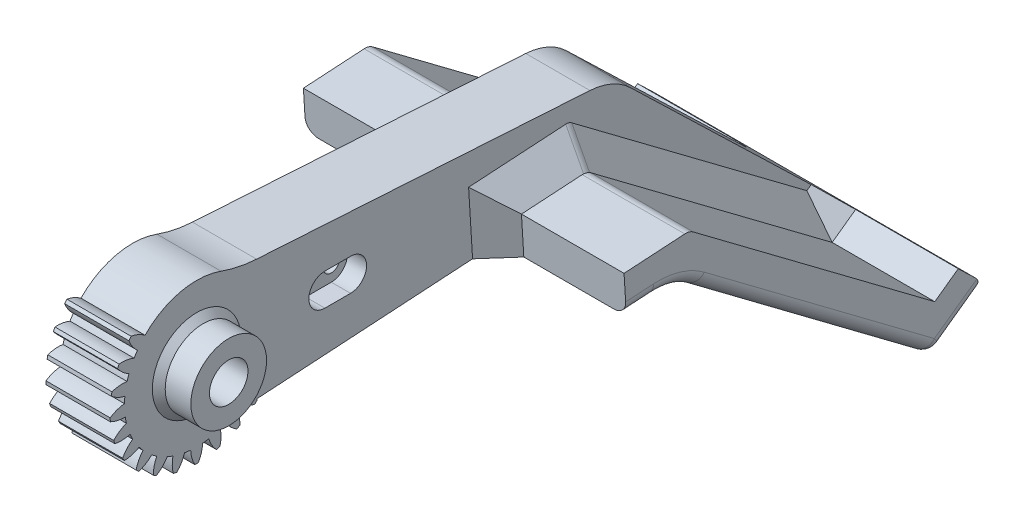
from build123d import *

# Parameters (mm, degrees)
BASPROSKE_W              = 10
BASPROSKE_H              = 13.5
TOOTHCUT_DEPTH           = 22.552262062
TEETHCUTS_COUNT          = 25
BORSKE_R                 = 4
BORE_DEPTH               = 50.0000508
BOSS_EXTRUDE1_DEPTH      = 10
CUT_EXTRUDE4_DEPTH       = 1
SKETCH6_R                = 1.25
CUT_EXTRUDE5_DEPTH       = 68.136055887
CUT_EXTRUDE6_DEPTH       = 3
SKETCH7_R                = 4
SKETCH7_R_2              = 3
BOSS_EXTRUDE2_DEPTH      = 9
BOSS_EXTRUDE3_START      = 5
SKETCH7_3_R              = 5.9
SKETCH7_3_R_2            = 3
BOSS_EXTRUDE3_DEPTH      = 5
CHAMFER1_SIZE            = 1
BOSS_EXTRUDE4_DEPTH      = 10
BOSS_EXTRUDE6_DEPTH      = 20
BOSS_EXTRUDE6_DEPTH_BACK = 30
CHAMFER3_SIZE            = 4
FILLET4_R                = 10
FILLET5_R                = 2
CUT_EXTRUDE7_START       = -10
CUT_EXTRUDE7_DEPTH       = 10
FILLET6_R                = 20


with BuildPart() as part:
    # BasProSke → Base-Revolve (revolve)
    with BuildSketch(Plane(origin=(0, 0, 0), x_dir=(1, 0, 0), z_dir=(0, 1, 0)), mode=Mode.PRIVATE) as base_revolve_sk:
        with Locations((5, 6.75)):
            Rectangle(BASPROSKE_W, BASPROSKE_H)
    revolve(base_revolve_sk.sketch.rotate(Axis((-10, 0, 0), (1, 0, 0)), 180), axis=Axis((-10, 0, 0), (1, 0, 0)))

    # TooCutSke → ToothCut (cut, through all)
    with BuildSketch(Plane(origin=(0, 0, 0), x_dir=(0, 0, -1), z_dir=(1, 0, 0))):
        with BuildLine():
            ThreePointArc((0.480087995, 11.238750665), (0, 11.249), (-0.480087995, 11.238750665))
            ThreePointArc((-0.480087995, 11.238750665), (-0.821124963, 12.40220054), (-1.432168974, 13.449361962))
            ThreePointArc((-1.432168974, 13.449361962), (0, 13.5254), (1.432168974, 13.449361962))
            ThreePointArc((1.432168974, 13.449361962), (0.821124963, 12.40220054), (0.480087995, 11.238750665))
        make_face()
    toothcut = extrude(amount=TOOTHCUT_DEPTH, mode=Mode.SUBTRACT)

    # TeethCuts: ToothCut ×25 about axis
    teethcuts_axis = Axis((0, 0, 0), (1, 0, 0))
    for i in range(1, TEETHCUTS_COUNT):
        add(toothcut.rotate(teethcuts_axis, i * 360 / TEETHCUTS_COUNT), mode=Mode.SUBTRACT)

    # BorSke → Bore (cut, symmetric)
    with BuildSketch(Plane(origin=(0, 0, 0), x_dir=(0, 0, -1), z_dir=(1, 0, 0))):
        with Locations(Location((0, 0, 0), (0, 0, 180))):
            Circle(BORSKE_R)
    extrude(amount=BORE_DEPTH, both=True, mode=Mode.SUBTRACT)

    # Sketch4 → Boss-Extrude1 (add)
    with BuildSketch(Plane(origin=(10, 0, 0), x_dir=(0, 0, -1), z_dir=(1, 0, 0))):
        with BuildLine():
            ThreePointArc((10, 0), (7.285994832, -6.849399923), (0.61714414, -9.980938488))
            Line((0.61714414, -9.980938488), (65, -6))
            Line((65, -6), (65, 6))
            Line((65, 6), (0.61714414, 9.980938488))
            ThreePointArc((0.61714414, 9.980938488), (7.285994832, 6.849399923), (10, 0))
        make_face()
    extrude(amount=-BOSS_EXTRUDE1_DEPTH)

    # Sketch5 → Cut-Extrude4 (cut)
    with BuildSketch(Plane.ZY):
        with BuildLine():
            Line((-28.5, 3.464101615), (-1.071428571, 7.42307489))
            ThreePointArc((-1.071428571, 7.42307489), (7.5, 0), (-1.071428571, -7.42307489))
            Line((-1.071428571, -7.42307489), (-28.5, -3.464101615))
            ThreePointArc((-28.5, -3.464101615), (-31.5, 0), (-28.5, 3.464101615))
        make_face()
    extrude(amount=-CUT_EXTRUDE4_DEPTH, mode=Mode.SUBTRACT)

    # Sketch6 → Cut-Extrude5 (cut, through all)
    with BuildSketch(Plane(origin=(10, 0, 0), x_dir=(0, 0, -1), z_dir=(1, 0, 0))):
        with Locations((20, 0)):
            Circle(SKETCH6_R)
        with Locations((24, 0)):
            Circle(SKETCH6_R)
    extrude(amount=-CUT_EXTRUDE5_DEPTH, mode=Mode.SUBTRACT)

    # Sketch6<3> → Cut-Extrude6 (cut)
    with BuildSketch(Plane(origin=(10, 0, 0), x_dir=(0, 0, -1), z_dir=(1, 0, 0))):
        with BuildLine():
            Line((20, 2.5), (24, 2.5))
            ThreePointArc((24, 2.5), (26.5, 0), (24, -2.5))
            Line((24, -2.5), (20, -2.5))
            ThreePointArc((20, -2.5), (17.5, 0), (20, 2.5))
        make_face()
    extrude(amount=-CUT_EXTRUDE6_DEPTH, mode=Mode.SUBTRACT)

    # Sketch7 → Boss-Extrude2 (add)
    with BuildSketch(Plane(origin=(10, 0, 0), x_dir=(0, 0, -1), z_dir=(1, 0, 0))):
        Circle(SKETCH7_R)
        Circle(SKETCH7_R_2, mode=Mode.SUBTRACT)
    extrude(amount=-BOSS_EXTRUDE2_DEPTH)

    # Sketch7<3> → Boss-Extrude3 (add)
    with BuildSketch(Plane(origin=(10, 0, 0), x_dir=(0, 0, -1), z_dir=(1, 0, 0)).offset(BOSS_EXTRUDE3_START)):
        with Locations(Location((0, 0, 0), (0, 0, 180))):
            Circle(SKETCH7_3_R)
        Circle(SKETCH7_3_R_2, mode=Mode.SUBTRACT)
    extrude(amount=-BOSS_EXTRUDE3_DEPTH)

    # Chamfer1
    chamfer1_edges = [part.edges().sort_by_distance(p)[0] for p in [
        (10, 0, -5.9),
    ]]
    chamfer(chamfer1_edges, length=CHAMFER1_SIZE)

    # Sketch8 → Boss-Extrude4 (add)
    with BuildSketch(Plane(origin=(10, 0, 0), x_dir=(0, 0, -1), z_dir=(1, 0, 0))):
        Polygon((65, -6), (55.019061512, -6.61714414), (95.019061512, -36.61714414), (103.148018869, -30.79305174), (65, 6), align=None)
    extrude(amount=-BOSS_EXTRUDE4_DEPTH)

    # Sketch13 → Boss-Extrude6 (add, two sides: drawn at the far end of the back side and taken through both)
    with BuildSketch(Plane(origin=(10, 0, 0), x_dir=(0, 0, -1), z_dir=(1, 0, 0)).offset(-BOSS_EXTRUDE6_DEPTH_BACK)):
        Polygon((95.019061512, -36.61714414), (103.148018869, -30.79305174), (98.757020985, -26.558016288), (95.100195272, -29.17799446), (56.852619126, -0.492312351), (46.648775028, -1.123239251), (47.019061512, -7.111802344), (55.019061512, -6.61714414), align=None)
    extrude(amount=BOSS_EXTRUDE6_DEPTH + BOSS_EXTRUDE6_DEPTH_BACK)

    # Chamfer3
    chamfer3_edges = [part.edges().sort_by_distance(p)[0] for p in [
        (0, -14.835153405, -75.976407199),
        (0, -0.807775801, -51.750697077),
        (10, -0.807775801, -51.750697077),
        (10, -14.835153405, -75.976407199),
        (10, -4.117520798, -46.83391827),
        (0, -4.117520798, -46.83391827),
        (10, -27.868005374, -96.928608129),
        (0, -27.868005374, -96.928608129),
    ]]
    chamfer(chamfer3_edges, length=CHAMFER3_SIZE)

    # Fillet4
    fillet4_edges = [part.edges().sort_by_distance(p)[0] for p in [
        (5, 6, -65),
        (5, -6.61714414, -55.019061512),
    ]]
    fillet(fillet4_edges, radius=FILLET4_R)

    # Fillet5
    # the kernel refuses this fillet: 2 mm, written as the material it takes off along each edge
    with BuildSketch(Plane(origin=(28, -34.13742758, -95.046106098), x_dir=(0, -0.8128957357715318, -0.5824092399374), z_dir=(1, 0, 0))) as fillet5_piece_1_section:
        Polygon((0, 0), (FILLET5_R, 0), (FILLET5_R, -FILLET5_R * 0.733097133134), (FILLET5_R * 0.300871044655, -FILLET5_R * 0.953664833413), align=None)
    fillet5_piece_1 = extrude(amount=FILLET5_R, mode=Mode.PRIVATE)
    fillet5_piece_1 = fillet5_piece_1 - Plane(origin=(28, -34.13742758, -95.046106098), x_dir=(0, 0.9999405313766578, -0.01090567330187733), z_dir=(1, 0, 0)) * Sphere(FILLET5_R, mode=Mode.PRIVATE)
    add(fillet5_piece_1, mode=Mode.SUBTRACT)
    with BuildSketch(Plane(origin=(-18, -34.13742758, -95.046106098), x_dir=(0, -0.8, 0.5999999999999999), z_dir=(-1, 0, 0))) as fillet5_piece_2_section:
        Polygon((0, 0), (FILLET5_R, 0), (FILLET5_R, -FILLET5_R * 0.733097133134), (FILLET5_R * 0.300871044655, -FILLET5_R * 0.953664833413), align=None)
    fillet5_piece_2 = extrude(amount=FILLET5_R, mode=Mode.PRIVATE)
    fillet5_piece_2 = fillet5_piece_2 - Plane(origin=(-18, -34.13742758, -95.046106098), x_dir=(0, 0.9999405313766578, -0.01090567330187733), z_dir=(-1, 0, 0)) * Sphere(FILLET5_R, mode=Mode.PRIVATE)
    add(fillet5_piece_2, mode=Mode.SUBTRACT)
    with BuildSketch(Plane(origin=(36.002852697, -30.79305174, -103.148018869), x_dir=(0, 0.6942085233990521, 0.7197739409287527), z_dir=(-1, 0, 0))) as fillet5_piece_3:
        with BuildLine():
            CenterArc((FILLET5_R * 1.20057053937, -FILLET5_R), FILLET5_R, 90, 100.415644969)
            Line((FILLET5_R * 0.217048397101, -FILLET5_R * 1.18078770883), (0, 0))
            Line((0, 0), (FILLET5_R * 1.20057053937, 0))
        make_face()
    extrude(amount=62.005705394, mode=Mode.SUBTRACT)
    with BuildSketch(Plane(origin=(28, -36.61714414, -95.019061512), x_dir=(0, 0.5824092399373941, -0.8128957357715361), z_dir=(-1, 0, 0))) as fillet5_piece_4:
        with BuildLine():
            CenterArc((FILLET5_R * 0.733097133134, -FILLET5_R), FILLET5_R, 90, 72.490072413)
            Line((-FILLET5_R * 0.220567700279, -FILLET5_R * 0.699128955345), (0, 0))
            Line((0, 0), (FILLET5_R * 0.733097133134, 0))
        make_face()
    extrude(amount=46, mode=Mode.SUBTRACT)
    with BuildSketch(Plane(origin=(-2.159955849, -0.492312351, -56.852619126), x_dir=(0, -0.6000000000000031, -0.7999999999999977), z_dir=(-1, 0, 0))) as fillet5_piece_5_section:
        with BuildLine():
            CenterArc((FILLET5_R * 0.368008830226, FILLET5_R), FILLET5_R, 229.591878484, 40.408121516)
            Line((-FILLET5_R * 0.280219010245, FILLET5_R * 0.238553569292), (0, 0))
            Line((0, 0), (FILLET5_R * 0.368008830226, 0))
        make_face()
    fillet5_piece_5 = extrude(amount=19.680088302, mode=Mode.PRIVATE)
    fillet5_piece_5 = split(fillet5_piece_5, bisect_by=Plane(origin=(-4.203231672, -0.458393673, -56.468674771), z_dir=(0.7071067811865478, -0.5656854249492378, 0.42426406871192845)), keep=Keep.TOP, mode=Mode.PRIVATE)
    fillet5_piece_5 = split(fillet5_piece_5, bisect_by=Plane(origin=(-4.06457193, -0.583055288, -56.4313555), z_dir=(-0.7071067811865477, 0.7057589287818163, 0.04363868060268578)), keep=Keep.TOP, mode=Mode.PRIVATE)
    add(fillet5_piece_5, mode=Mode.SUBTRACT)
    with BuildSketch(Plane(origin=(-2.159955849, -0.492312351, -56.852619126), x_dir=(0, -0.6000000000000031, -0.7999999999999977), z_dir=(-1, 0, 0))) as fillet5_piece_6_section:
        with BuildLine():
            CenterArc((FILLET5_R * 0.368008830226, FILLET5_R), FILLET5_R, 229.591878484, 40.408121516)
            Line((-FILLET5_R * 0.280219010245, FILLET5_R * 0.238553569292), (0, 0))
            Line((0, 0), (FILLET5_R * 0.368008830226, 0))
        make_face()
    fillet5_piece_6 = extrude(amount=19.680088302, mode=Mode.PRIVATE)
    fillet5_piece_6 = split(fillet5_piece_6, bisect_by=Plane(origin=(-4.06457193, -0.799606363, -57.154724593), z_dir=(-0.7071067811865478, 0.5656854249492378, -0.42426406871192845)), keep=Keep.TOP, mode=Mode.PRIVATE)
    fillet5_piece_6 = split(fillet5_piece_6, bisect_by=Plane(origin=(-4.203231672, -0.674944749, -57.192043864), z_dir=(0.7071067811865477, -0.7057589287818163, -0.04363868060268578)), keep=Keep.TOP, mode=Mode.PRIVATE)
    add(fillet5_piece_6, mode=Mode.SUBTRACT)
    with BuildSketch(Plane(origin=(-2.159955849, -0.492312351, -56.852619126), x_dir=(0, -0.6000000000000031, -0.7999999999999977), z_dir=(-1, 0, 0))) as fillet5_piece_7_section:
        with BuildLine():
            CenterArc((FILLET5_R * 0.368008830226, FILLET5_R), FILLET5_R, 229.591878484, 40.408121516)
            Line((-FILLET5_R * 0.280219010245, FILLET5_R * 0.238553569292), (0, 0))
            Line((0, 0), (FILLET5_R * 0.368008830226, 0))
        make_face()
    fillet5_piece_7 = extrude(amount=19.680088302, mode=Mode.PRIVATE)
    fillet5_piece_7 = split(fillet5_piece_7, bisect_by=Plane(origin=(-8.556310311, -4.159124807, -54.147851884), z_dir=(-0.7071067811865478, 0.5656854249492378, -0.42426406871192845)), keep=Keep.TOP, mode=Mode.PRIVATE)
    fillet5_piece_7 = split(fillet5_piece_7, bisect_by=Plane(origin=(-8.556310311, -5.042176254, -57.097604611), z_dir=(-0.7071067811865477, 0.7057589287818163, 0.04363868060268578)), keep=Keep.TOP, mode=Mode.PRIVATE)
    add(fillet5_piece_7, mode=Mode.SUBTRACT)
    with BuildSketch(Plane(origin=(-20, -7.420374414, -42.028592267), x_dir=(1, 0, 0), z_dir=(0, 0.061714413952385916, -0.9980938488491519))) as fillet5_piece_8:
        with BuildLine():
            CenterArc((FILLET5_R, -FILLET5_R), FILLET5_R, 90, 90)
            Line((0, -FILLET5_R), (0, 0))
            Line((0, 0), (FILLET5_R, 0))
        make_face()
    extrude(amount=9.33519003, mode=Mode.SUBTRACT)
    with BuildSketch(Plane(origin=(-20, -35.763219051, -96.210924578), x_dir=(1, 0, 0), z_dir=(0, 0.5824092399373993, -0.8128957357715324)), Plane(origin=(30, -35.763219051, -96.210924578), x_dir=(0, 0.8128957357715324, 0.5824092399373992), z_dir=(0, 0.5824092399373993, -0.8128957357715324))) as fillet5_piece_9:
        with BuildLine():
            CenterArc((FILLET5_R, -FILLET5_R), FILLET5_R, 90, 90)
            Line((0, -FILLET5_R), (0, 0))
            Line((0, 0), (FILLET5_R, 0))
        make_face()
    extrude(amount=13.533805734, mode=Mode.SUBTRACT)
    with BuildSketch(Plane(origin=(30, -7.420374414, -42.028592267), x_dir=(-1, 0, 0), z_dir=(0, 0.061714413952385916, -0.9980938488491519))) as fillet5_piece_10:
        with BuildLine():
            CenterArc((FILLET5_R, FILLET5_R), FILLET5_R, 180, 90)
            Line((0, FILLET5_R), (0, 0))
            Line((0, 0), (FILLET5_R, 0))
        make_face()
    extrude(amount=9.33519003, mode=Mode.SUBTRACT)
    with BuildSketch(Plane(origin=(31.840044151, -0.492312351, -56.852619126), x_dir=(0, -0.6000000000000031, -0.7999999999999977), z_dir=(-1, 0, 0))) as fillet5_piece_11_section:
        with BuildLine():
            CenterArc((FILLET5_R * 0.368008830226, FILLET5_R), FILLET5_R, 229.591878484, 40.408121516)
            Line((-FILLET5_R * 0.280219010245, FILLET5_R * 0.238553569292), (0, 0))
            Line((0, 0), (FILLET5_R * 0.368008830226, 0))
        make_face()
    fillet5_piece_11 = extrude(amount=19.680088302, mode=Mode.PRIVATE)
    fillet5_piece_11 = split(fillet5_piece_11, bisect_by=Plane(origin=(18.556310311, -4.159124807, -54.147851884), z_dir=(0.7071067811865477, 0.5656854249492382, -0.42426406871192823)), keep=Keep.TOP, mode=Mode.PRIVATE)
    fillet5_piece_11 = split(fillet5_piece_11, bisect_by=Plane(origin=(18.556310311, -5.042176254, -57.097604611), z_dir=(0.7071067811865477, 0.7057589287818162, 0.04363868060268581)), keep=Keep.TOP, mode=Mode.PRIVATE)
    add(fillet5_piece_11, mode=Mode.SUBTRACT)
    with BuildSketch(Plane(origin=(31.840044151, -0.492312351, -56.852619126), x_dir=(0, -0.6000000000000031, -0.7999999999999977), z_dir=(-1, 0, 0))) as fillet5_piece_12_section:
        with BuildLine():
            CenterArc((FILLET5_R * 0.368008830226, FILLET5_R), FILLET5_R, 229.591878484, 40.408121516)
            Line((-FILLET5_R * 0.280219010245, FILLET5_R * 0.238553569292), (0, 0))
            Line((0, 0), (FILLET5_R * 0.368008830226, 0))
        make_face()
    fillet5_piece_12 = extrude(amount=19.680088302, mode=Mode.PRIVATE)
    fillet5_piece_12 = split(fillet5_piece_12, bisect_by=Plane(origin=(14.203231672, -0.458393673, -56.468674771), z_dir=(-0.7071067811865477, -0.5656854249492382, 0.42426406871192823)), keep=Keep.TOP, mode=Mode.PRIVATE)
    fillet5_piece_12 = split(fillet5_piece_12, bisect_by=Plane(origin=(14.06457193, -0.583055288, -56.4313555), z_dir=(0.7071067811865477, 0.7057589287818162, 0.04363868060268581)), keep=Keep.TOP, mode=Mode.PRIVATE)
    add(fillet5_piece_12, mode=Mode.SUBTRACT)
    with BuildSketch(Plane(origin=(31.840044151, -0.492312351, -56.852619126), x_dir=(0, -0.6000000000000031, -0.7999999999999977), z_dir=(-1, 0, 0))) as fillet5_piece_13_section:
        with BuildLine():
            CenterArc((FILLET5_R * 0.368008830226, FILLET5_R), FILLET5_R, 229.591878484, 40.408121516)
            Line((-FILLET5_R * 0.280219010245, FILLET5_R * 0.238553569292), (0, 0))
            Line((0, 0), (FILLET5_R * 0.368008830226, 0))
        make_face()
    fillet5_piece_13 = extrude(amount=19.680088302, mode=Mode.PRIVATE)
    fillet5_piece_13 = split(fillet5_piece_13, bisect_by=Plane(origin=(14.06457193, -0.799606363, -57.154724593), z_dir=(0.7071067811865477, 0.5656854249492382, -0.42426406871192823)), keep=Keep.TOP, mode=Mode.PRIVATE)
    fillet5_piece_13 = split(fillet5_piece_13, bisect_by=Plane(origin=(14.203231672, -0.674944749, -57.192043864), z_dir=(-0.7071067811865477, -0.7057589287818162, -0.04363868060268581)), keep=Keep.TOP, mode=Mode.PRIVATE)
    add(fillet5_piece_13, mode=Mode.SUBTRACT)
    with BuildSketch(Plane(origin=(0.861673631, 4.470509849, -58.338312244), x_dir=(0.17807400283141436, -0.438202960830783, -0.8810606191600738), z_dir=(-0.6843169218392868, -0.698554339417582, 0.20912241717536942))) as fillet5_piece_14_section:
        with BuildLine():
            CenterArc((FILLET5_R * 0.25183466991, FILLET5_R), FILLET5_R, 241.729727879, 28.270272121)
            Line((-FILLET5_R * 0.221796640221, FILLET5_R * 0.119276784646), (0, 0))
            Line((0, 0), (FILLET5_R * 0.25183466991, 0))
        make_face()
    fillet5_piece_14 = extrude(amount=8.363591603, mode=Mode.PRIVATE)
    fillet5_piece_14 = split(fillet5_piece_14, bisect_by=Plane(origin=(0, 1.554477972, -57.465355625), z_dir=(-1, 0, 0)), keep=Keep.TOP, mode=Mode.PRIVATE)
    fillet5_piece_14 = split(fillet5_piece_14, bisect_by=Plane(origin=(-1.935281767, -0.049581354, -56.26231113), z_dir=(0, 0.8000000000000003, -0.5999999999999998)), keep=Keep.TOP, mode=Mode.PRIVATE)
    fillet5_piece_14 = split(fillet5_piece_14, bisect_by=Plane(origin=(-1.935281767, -0.446774211, -57.589097601), z_dir=(0, 0.9980938488491519, 0.061714413952385944)), keep=Keep.TOP, mode=Mode.PRIVATE)
    add(fillet5_piece_14, mode=Mode.SUBTRACT)
    with BuildSketch(Plane(origin=(0.861673631, 4.470509849, -58.338312244), x_dir=(0.17807400283141436, -0.438202960830783, -0.8810606191600738), z_dir=(-0.6843169218392868, -0.698554339417582, 0.20912241717536942))) as fillet5_piece_15_section:
        with BuildLine():
            CenterArc((FILLET5_R * 0.25183466991, FILLET5_R), FILLET5_R, 241.729727879, 28.270272121)
            Line((-FILLET5_R * 0.221796640221, FILLET5_R * 0.119276784646), (0, 0))
            Line((0, 0), (FILLET5_R * 0.25183466991, 0))
        make_face()
    fillet5_piece_15 = extrude(amount=8.363591603, mode=Mode.PRIVATE)
    fillet5_piece_15 = split(fillet5_piece_15, bisect_by=Plane(origin=(-3.914909167, -0.322114943, -56.62568925), z_dir=(0, -0.8000000000000003, 0.5999999999999998)), keep=Keep.TOP, mode=Mode.PRIVATE)
    fillet5_piece_15 = split(fillet5_piece_15, bisect_by=Plane(origin=(-3.914909167, -0.509818406, -56.569497483), z_dir=(0, 0.9980938488491519, 0.061714413952385944)), keep=Keep.TOP, mode=Mode.PRIVATE)
    add(fillet5_piece_15, mode=Mode.SUBTRACT)
    with BuildSketch(Plane(origin=(0.861673631, 4.470509849, -58.338312244), x_dir=(0.17807400283141436, -0.438202960830783, -0.8810606191600738), z_dir=(-0.6843169218392868, -0.698554339417582, 0.20912241717536942))) as fillet5_piece_16_section:
        with BuildLine():
            CenterArc((FILLET5_R * 0.25183466991, FILLET5_R), FILLET5_R, 241.729727879, 28.270272121)
            Line((-FILLET5_R * 0.221796640221, FILLET5_R * 0.119276784646), (0, 0))
            Line((0, 0), (FILLET5_R * 0.25183466991, 0))
        make_face()
    fillet5_piece_16 = extrude(amount=8.363591603, mode=Mode.PRIVATE)
    fillet5_piece_16 = split(fillet5_piece_16, bisect_by=Plane(origin=(-3.914909167, -0.662509759, -57.079549004), z_dir=(0, 0.8000000000000003, -0.5999999999999998)), keep=Keep.TOP, mode=Mode.PRIVATE)
    fillet5_piece_16 = split(fillet5_piece_16, bisect_by=Plane(origin=(-3.914909167, -0.474806295, -57.135740769), z_dir=(0, -0.9980938488491519, -0.061714413952385944)), keep=Keep.TOP, mode=Mode.PRIVATE)
    add(fillet5_piece_16, mode=Mode.SUBTRACT)
    with BuildSketch(Plane(origin=(9.138326369, 4.470509849, -58.338312244), x_dir=(-0.17807400283141542, -0.43820296083078264, -0.8810606191600739), z_dir=(0.6843169218392869, -0.698554339417582, 0.20912241717536834))) as fillet5_piece_17_section:
        with BuildLine():
            CenterArc((FILLET5_R * 0.25183466991, -FILLET5_R), FILLET5_R, 90, 28.270272121)
            Line((-FILLET5_R * 0.221796640221, -FILLET5_R * 0.119276784646), (0, 0))
            Line((0, 0), (FILLET5_R * 0.25183466991, 0))
        make_face()
    fillet5_piece_17 = extrude(amount=8.363591603, mode=Mode.PRIVATE)
    fillet5_piece_17 = split(fillet5_piece_17, bisect_by=Plane(origin=(10, 1.554477972, -57.465355625), z_dir=(1, 0, 0)), keep=Keep.TOP, mode=Mode.PRIVATE)
    fillet5_piece_17 = split(fillet5_piece_17, bisect_by=Plane(origin=(11.935281767, -0.049581354, -56.26231113), z_dir=(0, 0.8000000000000003, -0.5999999999999998)), keep=Keep.TOP, mode=Mode.PRIVATE)
    fillet5_piece_17 = split(fillet5_piece_17, bisect_by=Plane(origin=(11.935281767, -0.446774211, -57.589097601), z_dir=(0, 0.9980938488491519, 0.061714413952385944)), keep=Keep.TOP, mode=Mode.PRIVATE)
    add(fillet5_piece_17, mode=Mode.SUBTRACT)
    with BuildSketch(Plane(origin=(9.138326369, 4.470509849, -58.338312244), x_dir=(-0.17807400283141542, -0.43820296083078264, -0.8810606191600739), z_dir=(0.6843169218392869, -0.698554339417582, 0.20912241717536834))) as fillet5_piece_18_section:
        with BuildLine():
            CenterArc((FILLET5_R * 0.25183466991, -FILLET5_R), FILLET5_R, 90, 28.270272121)
            Line((-FILLET5_R * 0.221796640221, -FILLET5_R * 0.119276784646), (0, 0))
            Line((0, 0), (FILLET5_R * 0.25183466991, 0))
        make_face()
    fillet5_piece_18 = extrude(amount=8.363591603, mode=Mode.PRIVATE)
    fillet5_piece_18 = split(fillet5_piece_18, bisect_by=Plane(origin=(13.914909167, -0.322114943, -56.62568925), z_dir=(0, -0.8000000000000003, 0.5999999999999998)), keep=Keep.TOP, mode=Mode.PRIVATE)
    fillet5_piece_18 = split(fillet5_piece_18, bisect_by=Plane(origin=(13.914909167, -0.509818406, -56.569497483), z_dir=(0, 0.9980938488491519, 0.061714413952385944)), keep=Keep.TOP, mode=Mode.PRIVATE)
    add(fillet5_piece_18, mode=Mode.SUBTRACT)
    with BuildSketch(Plane(origin=(9.138326369, 4.470509849, -58.338312244), x_dir=(-0.17807400283141542, -0.43820296083078264, -0.8810606191600739), z_dir=(0.6843169218392869, -0.698554339417582, 0.20912241717536834))) as fillet5_piece_19_section:
        with BuildLine():
            CenterArc((FILLET5_R * 0.25183466991, -FILLET5_R), FILLET5_R, 90, 28.270272121)
            Line((-FILLET5_R * 0.221796640221, -FILLET5_R * 0.119276784646), (0, 0))
            Line((0, 0), (FILLET5_R * 0.25183466991, 0))
        make_face()
    fillet5_piece_19 = extrude(amount=8.363591603, mode=Mode.PRIVATE)
    fillet5_piece_19 = split(fillet5_piece_19, bisect_by=Plane(origin=(13.914909167, -0.662509759, -57.079549004), z_dir=(0, 0.8000000000000003, -0.5999999999999998)), keep=Keep.TOP, mode=Mode.PRIVATE)
    fillet5_piece_19 = split(fillet5_piece_19, bisect_by=Plane(origin=(13.914909167, -0.474806295, -57.135740769), z_dir=(0, -0.9980938488491519, -0.061714413952385944)), keep=Keep.TOP, mode=Mode.PRIVATE)
    add(fillet5_piece_19, mode=Mode.SUBTRACT)
    with BuildSketch(Plane(origin=(30, -8.825197121, -57.963132153), x_dir=(0, 0.8, -0.5999999999999999), z_dir=(0, -0.6, -0.8000000000000002))) as fillet5_piece_20:
        with BuildLine():
            CenterArc((FILLET5_R, -FILLET5_R), FILLET5_R, 90, 90)
            Line((0, -FILLET5_R), (0, 0))
            Line((0, 0), (FILLET5_R, 0))
        make_face()
    extrude(amount=44.853717431, mode=Mode.SUBTRACT)
    with BuildSketch(Plane(origin=(-20, -8.825197121, -57.963132153), x_dir=(0, 0.8, -0.5999999999999999), z_dir=(0, -0.6, -0.8000000000000002))) as fillet5_piece_21:
        with BuildLine():
            CenterArc((FILLET5_R, FILLET5_R), FILLET5_R, 180, 90)
            Line((0, FILLET5_R), (0, 0))
            Line((0, 0), (FILLET5_R, 0))
        make_face()
    extrude(amount=44.853717431, mode=Mode.SUBTRACT)
    with BuildSketch(Plane(origin=(30, -16.825197121, -51.963132153), x_dir=(0, 0.9980938488491518, 0.06171441395238658), z_dir=(0, -0.06171441395238658, 0.9980938488491518))) as fillet5_piece_22:
        with BuildLine():
            CenterArc((10 + FILLET5_R, FILLET5_R), FILLET5_R, 180, 90)
            Line((10, FILLET5_R), (10, 0))
            Line((10, 0), (10 + FILLET5_R, 0))
        make_face()
    revolve(axis=Axis((30, -16.825197121, -51.963132153), (-1, 0, 0)), revolution_arc=40.408121516, mode=Mode.SUBTRACT)
    with BuildSketch(Plane(origin=(-20, -16.825197121, -51.963132153), x_dir=(0, 0.9980938488491518, 0.06171441395238658), z_dir=(0, -0.06171441395238658, 0.9980938488491518))) as fillet5_piece_23:
        with BuildLine():
            CenterArc((10 + FILLET5_R, -FILLET5_R), FILLET5_R, 90, 90)
            Line((10, -FILLET5_R), (10, 0))
            Line((10, 0), (10 + FILLET5_R, 0))
        make_face()
    revolve(axis=Axis((-20, -16.825197121, -51.963132153), (-1, 0, 0)), revolution_arc=40.408121516, mode=Mode.SUBTRACT)
    with BuildSketch(Plane(origin=(0.861673631, 4.470509849, -58.338312244), x_dir=(0.17807400283141436, -0.438202960830783, -0.8810606191600738), z_dir=(-0.6843169218392868, -0.698554339417582, 0.20912241717536942))) as fillet5_piece_24a_section:
        with BuildLine():
            CenterArc((FILLET5_R * 0.25183466991, FILLET5_R), FILLET5_R, 241.729727879, 28.270272121)
            Line((-FILLET5_R * 0.221796640221, FILLET5_R * 0.119276784646), (0, 0))
            Line((0, 0), (FILLET5_R * 0.25183466991, 0))
        make_face()
    fillet5_piece_24a = extrude(amount=8.363591603, mode=Mode.PRIVATE)
    fillet5_piece_24a = split(fillet5_piece_24a, bisect_by=Plane(origin=(-4.419603952, -0.598140574, -56.993723424), z_dir=(0, -0.8000000000000003, 0.5999999999999998)), keep=Keep.TOP, mode=Mode.PRIVATE)
    fillet5_piece_24a = split(fillet5_piece_24a, bisect_by=Plane(origin=(-4.419603952, -0.503197562, -56.676574963), z_dir=(0, -0.9980938488491519, -0.061714413952385944)), keep=Keep.TOP, mode=Mode.PRIVATE)
    with BuildSketch(Plane(origin=(-2.159955849, -0.492312351, -56.852619126), x_dir=(0, -0.6000000000000031, -0.7999999999999977), z_dir=(-1, 0, 0))) as fillet5_piece_24b_section:
        with BuildLine():
            CenterArc((FILLET5_R * 0.368008830226, FILLET5_R), FILLET5_R, 229.591878484, 40.408121516)
            Line((-FILLET5_R * 0.280219010245, FILLET5_R * 0.238553569292), (0, 0))
            Line((0, 0), (FILLET5_R * 0.368008830226, 0))
        make_face()
    fillet5_piece_24b = extrude(amount=19.680088302, mode=Mode.PRIVATE)
    fillet5_piece_24b = split(fillet5_piece_24b, bisect_by=Plane(origin=(-3.591892486, -0.187676207, -57.126616791), z_dir=(0.7071067811865478, -0.5656854249492378, 0.42426406871192845)), keep=Keep.TOP, mode=Mode.PRIVATE)
    fillet5_piece_24b = split(fillet5_piece_24b, bisect_by=Plane(origin=(-3.591892486, -0.087230171, -56.79108598), z_dir=(0.7071067811865477, -0.7057589287818163, -0.04363868060268578)), keep=Keep.TOP, mode=Mode.PRIVATE)
    fillet5_piece_24 = fillet5_piece_24a & fillet5_piece_24b
    add(fillet5_piece_24, mode=Mode.SUBTRACT)
    with BuildSketch(Plane(origin=(9.138326369, 4.470509849, -58.338312244), x_dir=(-0.17807400283141542, -0.43820296083078264, -0.8810606191600739), z_dir=(0.6843169218392869, -0.698554339417582, 0.20912241717536834))) as fillet5_piece_25a_section:
        with BuildLine():
            CenterArc((FILLET5_R * 0.25183466991, -FILLET5_R), FILLET5_R, 90, 28.270272121)
            Line((-FILLET5_R * 0.221796640221, -FILLET5_R * 0.119276784646), (0, 0))
            Line((0, 0), (FILLET5_R * 0.25183466991, 0))
        make_face()
    fillet5_piece_25a = extrude(amount=8.363591603, mode=Mode.PRIVATE)
    fillet5_piece_25a = split(fillet5_piece_25a, bisect_by=Plane(origin=(14.419603952, -0.598140574, -56.993723424), z_dir=(0, -0.8000000000000003, 0.5999999999999998)), keep=Keep.TOP, mode=Mode.PRIVATE)
    fillet5_piece_25a = split(fillet5_piece_25a, bisect_by=Plane(origin=(14.419603952, -0.503197562, -56.676574963), z_dir=(0, -0.9980938488491519, -0.061714413952385944)), keep=Keep.TOP, mode=Mode.PRIVATE)
    with BuildSketch(Plane(origin=(31.840044151, -0.492312351, -56.852619126), x_dir=(0, -0.6000000000000031, -0.7999999999999977), z_dir=(-1, 0, 0))) as fillet5_piece_25b_section:
        with BuildLine():
            CenterArc((FILLET5_R * 0.368008830226, FILLET5_R), FILLET5_R, 229.591878484, 40.408121516)
            Line((-FILLET5_R * 0.280219010245, FILLET5_R * 0.238553569292), (0, 0))
            Line((0, 0), (FILLET5_R * 0.368008830226, 0))
        make_face()
    fillet5_piece_25b = extrude(amount=19.680088302, mode=Mode.PRIVATE)
    fillet5_piece_25b = split(fillet5_piece_25b, bisect_by=Plane(origin=(13.591892486, -0.187676207, -57.126616791), z_dir=(-0.7071067811865477, -0.5656854249492382, 0.42426406871192823)), keep=Keep.TOP, mode=Mode.PRIVATE)
    fillet5_piece_25b = split(fillet5_piece_25b, bisect_by=Plane(origin=(13.591892486, -0.087230171, -56.79108598), z_dir=(-0.7071067811865477, -0.7057589287818162, -0.04363868060268581)), keep=Keep.TOP, mode=Mode.PRIVATE)
    fillet5_piece_25 = fillet5_piece_25a & fillet5_piece_25b
    add(fillet5_piece_25, mode=Mode.SUBTRACT)

    # Sketch14 → Cut-Extrude7 (cut)
    with BuildSketch(Plane(origin=(10, 0, 0), x_dir=(0, 0, -1), z_dir=(1, 0, 0)).offset(CUT_EXTRUDE7_START)):
        with BuildLine():
            Line((5.759023069, 9.663004413), (7.865329372, 9.532766701))
            Line((7.865329372, 9.532766701), (14.951175744, 9.094632696))
            ThreePointArc((14.951175744, 9.094632696), (2.727699945, 17.286111564), (-11.424214617, 13.256595354))
            Line((-11.424214617, 13.256595354), (-7.343485156, 8.521339494))
            ThreePointArc((-7.343485156, 8.521339494), (-0.976462863, 11.206539219), (5.759023069, 9.663004413))
        make_face()
    extrude(amount=CUT_EXTRUDE7_DEPTH, mode=Mode.SUBTRACT)

    # Fillet6
    fillet6_edges = [part.edges().sort_by_distance(p)[0] for p in [
        (5, 9.663004413, -5.759023069),
    ]]
    fillet(fillet6_edges, radius=FILLET6_R)


solid = part.part
